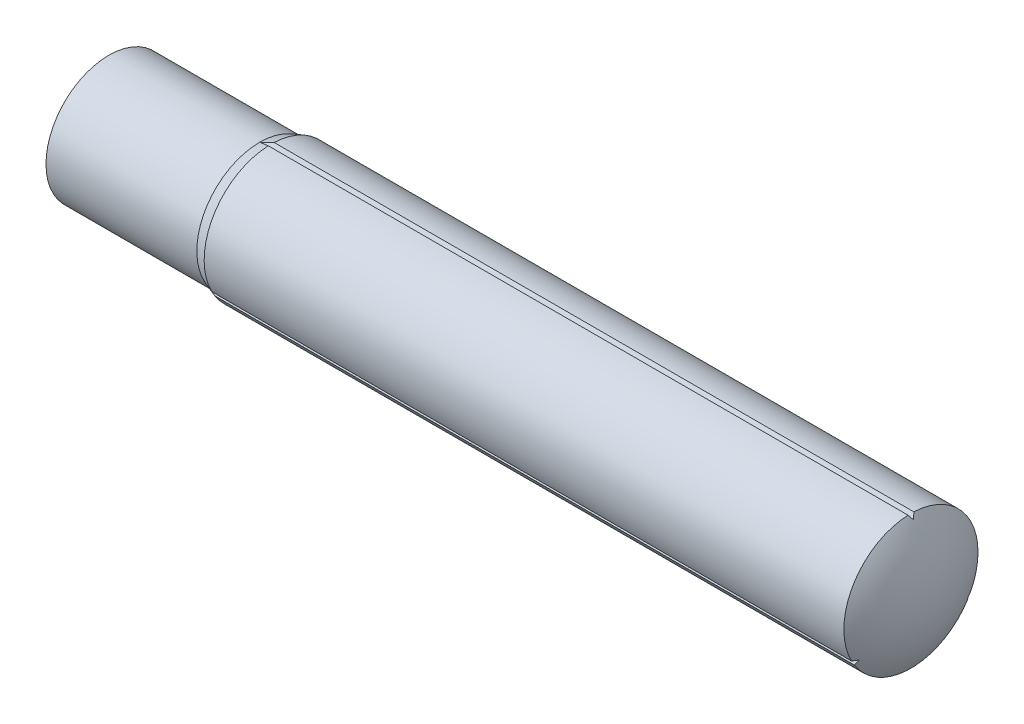
from build123d import *

# Parameters (mm, degrees)
CUT_EXTRUDE1_DEPTH = 11.0637965
CIRPATTERN1_COUNT  = 3


with BuildPart() as part:
    # Sketch1 → Base-Revolve (revolve)
    with BuildSketch(Plane.XY):
        with BuildLine():
            Line((0, 0), (10, 0))
            ThreePointArc((10, 0), (9.941056319, 0.416361243), (9.768857754, 0.8))
            Line((9.768857754, 0.8), (2.137373871, 0.8))
            Line((2.137373871, 0.8), (2, 0.75))
            Line((2, 0.75), (0.200961894, 0.75))
            ThreePointArc((0.200961894, 0.75), (0.051111261, 0.388228568), (0, 0))
        make_face()
    revolve(axis=Axis((-11.16342566, 0, 0), (1, 0, 0)))

    # Sketch2 → Cut-Extrude1 (cut, through all)
    with BuildSketch(Plane(origin=(0, 0, 0), x_dir=(0, 0, -1), z_dir=(1, 0, 0))):
        Polygon((-0.035010377, 0.8), (0, 0.75), (0.035010377, 0.8), align=None)
    cut_extrude1 = extrude(amount=CUT_EXTRUDE1_DEPTH, mode=Mode.SUBTRACT)

    # CirPattern1: Cut-Extrude1 ×3 about axis
    cirpattern1_axis = Axis((-11.16342566, 0, 0), (1, 0, 0))
    for i in range(1, CIRPATTERN1_COUNT):
        add(cut_extrude1.rotate(cirpattern1_axis, i * 360 / CIRPATTERN1_COUNT), mode=Mode.SUBTRACT)


solid = part.part
